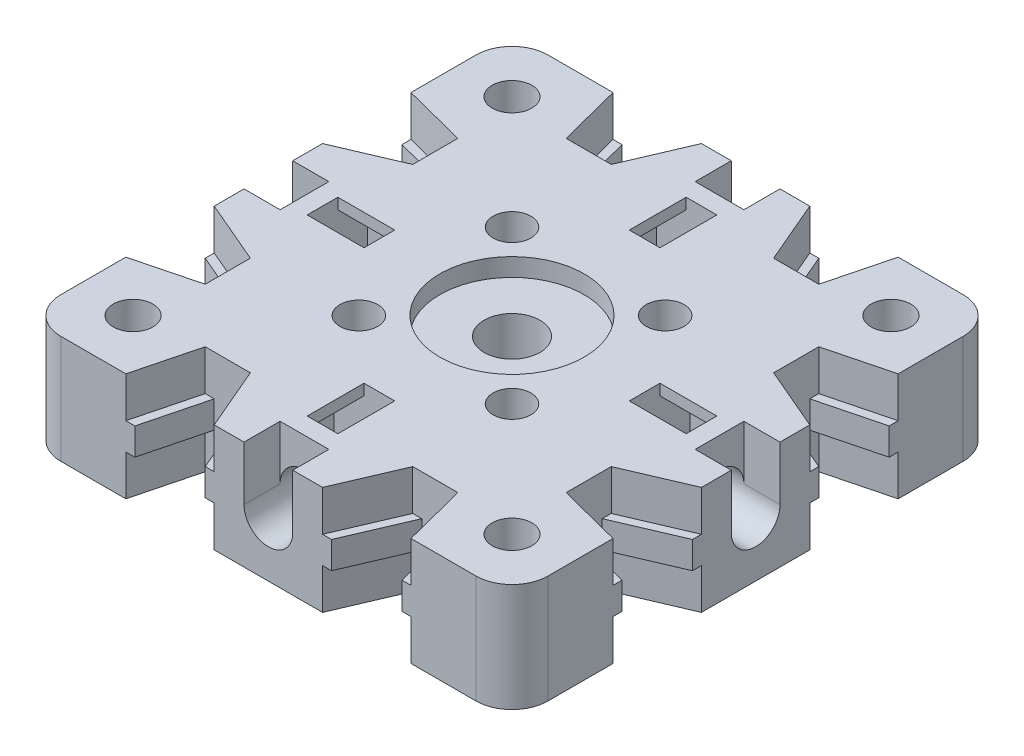
from build123d import *

# Parameters (mm, degrees)
SKETCH_3_W                      = 27
SKETCH_3_H                      = 27
EXTRUDE_1_DEPTH                 = 3
FILLET_1_R                      = 2
SKETCH_4_R                      = 1.1
CUT_EXTRUDE_1_DEPTH             = 6
SKETCH_5_R                      = 1.55
CUT_EXTRUDE_2_DEPTH             = 6
SKETCH_6_R                      = 1.05
CUT_EXTRUDE_3_DEPTH             = 6
PATTERN_CIRCULAR_1_COUNT        = 4
SKETCH_7_R                      = 4
CUT_EXTRUDE_4_DEPTH             = 1
SKETCH_8_W                      = 11.2
SKETCH_8_H                      = 11.2
CUT_EXTRUDE_5_DEPTH             = 2.5
CUT_EXTRUDE_8_DEPTH             = 21.012496096
PATTERN_CIRCULAR_2_COUNT        = 4
PATTERN_CIRCULAR_2_COPY_1_DEPTH = 21.012496096
PATTERN_CIRCULAR_2_COPY_2_DEPTH = 21.012496096
PATTERN_CIRCULAR_2_COPY_3_DEPTH = 21.012496096
SKETCH_12_R                     = 1.35
CUT_EXTRUDE_9_DEPTH             = 8
PATTERN_CIRCULAR_3_COUNT        = 4
EXTRUDE_2_DEPTH                 = 0.75
PATTERN_CIRCULAR_4_COUNT        = 4
PATTERN_CIRCULAR_4_COPY_1_DEPTH = 0.75
PATTERN_CIRCULAR_4_COPY_2_DEPTH = 0.75
PATTERN_CIRCULAR_4_COPY_3_DEPTH = 0.75
CUT_EXTRUDE_10_DEPTH            = 3.15
SKETCH_15_W                     = 2.7
SKETCH_15_H                     = 1.85
CUT_EXTRUDE_11_DEPTH            = 3
PATTERN_CIRCULAR_5_COUNT        = 4
CUT_EXTRUDE_12_DEPTH            = 4.1
CUT_EXTRUDE_13_DEPTH            = 1
PATTERN_CIRCULAR_6_COUNT        = 4
CUT_EXTRUDE_14_DEPTH            = 3.8
PATTERN_CIRCULAR_7_COUNT        = 4
SKETCH_22_W                     = 2.7
SKETCH_22_H                     = 3
CUT_EXTRUDE_15_DEPTH            = 2
CUT_EXTRUDE_16_DEPTH            = 3.5
PATTERN_CIRCULAR_8_COUNT        = 4
FILLET_2_R                      = 0.3
SKETCH_25_W                     = 3.009788056
SKETCH_25_H                     = 3.009788056
CUT_EXTRUDE_17_DEPTH            = 2.5
PATTERN_CIRCULAR_10_COUNT       = 4
FILLET_3_R                      = 0.3
PATTERN_CIRCULAR_11_COUNT       = 4


with BuildPart() as part:
    # ｽｹｯﾁ3 → ﾎﾞｽ - 押し出し1 (new, symmetric)
    with BuildSketch(Plane(origin=(0, 0, 0), x_dir=(1, 0, 0), z_dir=(0, 1, 0))):
        Rectangle(SKETCH_3_W, SKETCH_3_H)
    extrude(amount=EXTRUDE_1_DEPTH, both=True)

    # ﾌｨﾚｯﾄ1
    fillet_1_edges = [part.edges().sort_by_distance(p)[0] for p in [
        (13.5, 0, 13.5),
        (-13.5, 0, 13.5),
        (-13.5, 0, -13.5),
        (13.5, 0, -13.5),
    ]]
    fillet(fillet_1_edges, radius=FILLET_1_R)

    # ｽｹｯﾁ4 → ｶｯﾄ - 押し出し1 (cut)
    with BuildSketch(Plane(origin=(0, 3, 0), x_dir=(1, 0, 0), z_dir=(0, 1, 0))):
        with Locations(Location((-10.5, 10.5, 0), (0, 0, 270))):
            Circle(SKETCH_4_R)
        with Locations(Location((10.5, 10.5, 0), (0, 0, 270))):
            Circle(SKETCH_4_R)
        with Locations(Location((-10.5, -10.5, 0), (0, 0, 270))):
            Circle(SKETCH_4_R)
        with Locations(Location((10.5, -10.5, 0), (0, 0, 270))):
            Circle(SKETCH_4_R)
    extrude(amount=-CUT_EXTRUDE_1_DEPTH, mode=Mode.SUBTRACT)

    # ｽｹｯﾁ5 → ｶｯﾄ - 押し出し2 (cut)
    with BuildSketch(Plane(origin=(0, 3, 0), x_dir=(1, 0, 0), z_dir=(0, 1, 0))):
        with Locations(Location((0, 0, 0), (0, 0, 270))):
            Circle(SKETCH_5_R)
    extrude(amount=-CUT_EXTRUDE_2_DEPTH, mode=Mode.SUBTRACT)

    # ｽｹｯﾁ6 → ｶｯﾄ - 押し出し3 (cut)
    with BuildSketch(Plane(origin=(0, 3, 0), x_dir=(1, 0, 0), z_dir=(0, 1, 0))):
        with Locations(Location((4.242640687, 4.242640687, 0), (0, 0, 270))):
            Circle(SKETCH_6_R)
    cut_extrude_3 = extrude(amount=-CUT_EXTRUDE_3_DEPTH, mode=Mode.SUBTRACT)

    # 円形ﾊﾟﾀｰﾝ1: ｶｯﾄ - 押し出し3 ×4 about axis
    pattern_circular_1_axis = Axis((0, 0, 0), (0, 1, 0))
    for i in range(1, PATTERN_CIRCULAR_1_COUNT):
        add(cut_extrude_3.rotate(pattern_circular_1_axis, i * 360 / PATTERN_CIRCULAR_1_COUNT), mode=Mode.SUBTRACT)

    # ｽｹｯﾁ7 → ｶｯﾄ - 押し出し4 (cut)
    with BuildSketch(Plane(origin=(0, 3, 0), x_dir=(1, 0, 0), z_dir=(0, 1, 0))):
        with Locations(Location((0, 0, 0), (0, 0, 270))):
            Circle(SKETCH_7_R)
    extrude(amount=-CUT_EXTRUDE_4_DEPTH, mode=Mode.SUBTRACT)

    # ｽｹｯﾁ8 → ｶｯﾄ - 押し出し5 (cut)
    with BuildSketch(Plane.XZ.offset(3)):
        Rectangle(SKETCH_8_W, SKETCH_8_H)
    extrude(amount=-CUT_EXTRUDE_5_DEPTH, mode=Mode.SUBTRACT)

    # ｽｹｯﾁ11 → ｶｯﾄ - 押し出し8 (cut, symmetric)
    with BuildSketch(Plane(origin=(0, 3, 0), x_dir=(1, 0, 0), z_dir=(0, 1, 0))):
        Polygon((-28.082033535, 86.024744916), (3, 13.5), (4.5, 10), (7, 10), (7.9, 13.5), (27.55047658, 89.918520033), (16.532211377, 247.342544779), (-39.100298738, 243.448769662), align=None)
    cut_extrude_8 = extrude(amount=CUT_EXTRUDE_8_DEPTH, both=True, mode=Mode.SUBTRACT)

    # ﾐﾗｰ1: ｶｯﾄ - 押し出し8 across plane
    add(cut_extrude_8.mirror(Plane(origin=(0, 0, 0), x_dir=(0, 0, 1), z_dir=(1, 0, 0))), mode=Mode.SUBTRACT)

    # 円形ﾊﾟﾀｰﾝ2: ｶｯﾄ - 押し出し8 ×4 about axis
    pattern_circular_2_axis = Axis((0, 0, 0), (0, 1, 0))
    for i in range(1, PATTERN_CIRCULAR_2_COUNT):
        add(cut_extrude_8.rotate(pattern_circular_2_axis, i * 360 / PATTERN_CIRCULAR_2_COUNT), mode=Mode.SUBTRACT)

    # 円形ﾊﾟﾀｰﾝ2 copy 1 sketch → 円形ﾊﾟﾀｰﾝ2 copy 1 (cut, symmetric)
    with BuildSketch(Plane.ZX.offset(3)):
        Polygon((-28.082033535, -86.024744916), (3, -13.5), (4.5, -10), (7, -10), (7.9, -13.5), (27.55047658, -89.918520033), (16.532211377, -247.342544779), (-39.100298738, -243.448769662), align=None)
    extrude(amount=PATTERN_CIRCULAR_2_COPY_1_DEPTH, both=True, mode=Mode.SUBTRACT)

    # 円形ﾊﾟﾀｰﾝ2 copy 2 sketch → 円形ﾊﾟﾀｰﾝ2 copy 2 (cut, symmetric)
    with BuildSketch(Plane(origin=(0, 3, 0), x_dir=(1, 0, 0), z_dir=(0, 1, 0))):
        Polygon((-28.082033535, -86.024744916), (3, -13.5), (4.5, -10), (7, -10), (7.9, -13.5), (27.55047658, -89.918520033), (16.532211377, -247.342544779), (-39.100298738, -243.448769662), align=None)
    extrude(amount=PATTERN_CIRCULAR_2_COPY_2_DEPTH, both=True, mode=Mode.SUBTRACT)

    # 円形ﾊﾟﾀｰﾝ2 copy 3 sketch → 円形ﾊﾟﾀｰﾝ2 copy 3 (cut, symmetric)
    with BuildSketch(Plane(origin=(0, 3, 0), x_dir=(0, 0, -1), z_dir=(0, 1, 0))):
        Polygon((-28.082033535, -86.024744916), (3, -13.5), (4.5, -10), (7, -10), (7.9, -13.5), (27.55047658, -89.918520033), (16.532211377, -247.342544779), (-39.100298738, -243.448769662), align=None)
    extrude(amount=PATTERN_CIRCULAR_2_COPY_3_DEPTH, both=True, mode=Mode.SUBTRACT)

    # ｽｹｯﾁ12 → ｶｯﾄ - 押し出し9 (cut)
    with BuildSketch(Plane.XY.offset(13.5)):
        Circle(SKETCH_12_R)
    cut_extrude_9 = extrude(amount=-CUT_EXTRUDE_9_DEPTH, mode=Mode.SUBTRACT)

    # 円形ﾊﾟﾀｰﾝ3: ｶｯﾄ - 押し出し9 ×4 about axis
    pattern_circular_3_axis = Axis((0, 0, 0), (0, 1, 0))
    for i in range(1, PATTERN_CIRCULAR_3_COUNT):
        add(cut_extrude_9.rotate(pattern_circular_3_axis, i * 360 / PATTERN_CIRCULAR_3_COUNT), mode=Mode.SUBTRACT)

    # ｽｹｯﾁ13 → ﾎﾞｽ - 押し出し2 (add, symmetric)
    with BuildSketch(Plane(origin=(0, 0, 0), x_dir=(1, 0, 0), z_dir=(0, 1, 0))):
        Polygon((7.9, 13.5), (7, 10), (6.5, 10), (7.4, 13.5), align=None)
        Polygon((3, 13.5), (3.5, 13.5), (5, 10), (4.5, 10), align=None)
    extrude_2 = extrude(amount=EXTRUDE_2_DEPTH, both=True)

    # ﾐﾗｰ2: ﾎﾞｽ - 押し出し2 across plane
    add(extrude_2.mirror(Plane(origin=(0, 0, 0), x_dir=(0, 0, 1), z_dir=(1, 0, 0))))

    # 円形ﾊﾟﾀｰﾝ4: ﾎﾞｽ - 押し出し2 ×4 about axis
    pattern_circular_4_axis = Axis((0, 0, 0), (0, 1, 0))
    for i in range(1, PATTERN_CIRCULAR_4_COUNT):
        add(extrude_2.rotate(pattern_circular_4_axis, i * 360 / PATTERN_CIRCULAR_4_COUNT))

    # 円形ﾊﾟﾀｰﾝ4 copy 1 sketch → 円形ﾊﾟﾀｰﾝ4 copy 1 (add, symmetric)
    with BuildSketch(Plane.ZX):
        Polygon((7.9, -13.5), (7, -10), (6.5, -10), (7.4, -13.5), align=None)
        Polygon((3, -13.5), (3.5, -13.5), (5, -10), (4.5, -10), align=None)
    extrude(amount=PATTERN_CIRCULAR_4_COPY_1_DEPTH, both=True)

    # 円形ﾊﾟﾀｰﾝ4 copy 2 sketch → 円形ﾊﾟﾀｰﾝ4 copy 2 (add, symmetric)
    with BuildSketch(Plane(origin=(0, 0, 0), x_dir=(1, 0, 0), z_dir=(0, 1, 0))):
        Polygon((7.9, -13.5), (7, -10), (6.5, -10), (7.4, -13.5), align=None)
        Polygon((3, -13.5), (3.5, -13.5), (5, -10), (4.5, -10), align=None)
    extrude(amount=PATTERN_CIRCULAR_4_COPY_2_DEPTH, both=True)

    # 円形ﾊﾟﾀｰﾝ4 copy 3 sketch → 円形ﾊﾟﾀｰﾝ4 copy 3 (add, symmetric)
    with BuildSketch(Plane(origin=(0, 0, 0), x_dir=(0, 0, -1), z_dir=(0, 1, 0))):
        Polygon((7.9, -13.5), (7, -10), (6.5, -10), (7.4, -13.5), align=None)
        Polygon((3, -13.5), (3.5, -13.5), (5, -10), (4.5, -10), align=None)
    extrude(amount=PATTERN_CIRCULAR_4_COPY_3_DEPTH, both=True)

    # ｽｹｯﾁ14 → ｶｯﾄ - 押し出し10 (cut)
    with BuildSketch(Plane(origin=(0, 0, -10.5), x_dir=(-1, 0, 0), z_dir=(0, 0, -1))):
        Polygon((-2.5, -1.443375673), (0, -2.886751346), (2.5, -1.443375673), (2.5, 1.443375673), (0.85, 2.396003617), (0.85, 0), (-0.85, 0), (-0.85, 2.396003617), (-2.5, 1.443375673), align=None)
        Polygon((0, 2.886751346), (0.85, 2.396003617), (0.85, 3), (-0.85, 3), (-0.85, 2.396003617), align=None)
        Polygon((0.85, 0), (0.85, 2.396003617), (0, 2.886751346), (-0.85, 2.396003617), (-0.85, 0), align=None)
        Polygon((-2.5, -3), (2.5, -3), (2.5, -1.443375673), (0, -2.886751346), (-2.5, -1.443375673), align=None)
    cut_extrude_10 = extrude(amount=-CUT_EXTRUDE_10_DEPTH, mode=Mode.SUBTRACT)

    # ｽｹｯﾁ15 → ｶｯﾄ - 押し出し11 (cut)
    with BuildSketch(Plane.XZ.offset(3)):
        with Locations((0, -6.425)):
            Rectangle(SKETCH_15_W, SKETCH_15_H)
    cut_extrude_11 = extrude(amount=-CUT_EXTRUDE_11_DEPTH, mode=Mode.SUBTRACT)

    # 円形ﾊﾟﾀｰﾝ5: ｶｯﾄ - 押し出し10, ｶｯﾄ - 押し出し11 ×4 about axis
    pattern_circular_5_axis = Axis((0, 0, 0), (0, 1, 0))
    add([cut_extrude_10.rotate(pattern_circular_5_axis, i * 360 / PATTERN_CIRCULAR_5_COUNT) for i in range(1, PATTERN_CIRCULAR_5_COUNT)], mode=Mode.SUBTRACT)
    add([cut_extrude_11.rotate(pattern_circular_5_axis, i * 360 / PATTERN_CIRCULAR_5_COUNT) for i in range(1, PATTERN_CIRCULAR_5_COUNT)], mode=Mode.SUBTRACT)

    # ｽｹｯﾁ16 → ｶｯﾄ - 押し出し12 (cut)
    with BuildSketch(Plane.XZ.offset(3)):
        Polygon((-9.849982783, 8.074102719), (-8.074102719, 9.849982783), (-8.724119936, 12.275880064), (-11.150017217, 12.925897281), (-12.925897281, 11.150017217), (-12.275880064, 8.724119936), align=None)
    cut_extrude_12 = extrude(amount=-CUT_EXTRUDE_12_DEPTH, mode=Mode.SUBTRACT)

    # ｽｹｯﾁ17 → ｶｯﾄ - 押し出し13 (cut)
    with BuildSketch(Plane.XZ.offset(3)):
        Polygon((0.883883476, 0.883883476), (-8.838299064, 10.606066017), (-10.606066017, 8.838299064), (-0.883883476, -0.883883476), align=None)
    cut_extrude_13 = extrude(amount=-CUT_EXTRUDE_13_DEPTH, mode=Mode.SUBTRACT)

    # 円形ﾊﾟﾀｰﾝ6: ｶｯﾄ - 押し出し12, ｶｯﾄ - 押し出し13 ×4 about axis
    pattern_circular_6_axis = Axis((0, 0, 0), (0, 1, 0))
    add([cut_extrude_12.rotate(pattern_circular_6_axis, i * 360 / PATTERN_CIRCULAR_6_COUNT) for i in range(1, PATTERN_CIRCULAR_6_COUNT)], mode=Mode.SUBTRACT)
    add([cut_extrude_13.rotate(pattern_circular_6_axis, i * 360 / PATTERN_CIRCULAR_6_COUNT) for i in range(1, PATTERN_CIRCULAR_6_COUNT)], mode=Mode.SUBTRACT)

    # ｽｹｯﾁ21 → ｶｯﾄ - 押し出し14 (cut)
    with BuildSketch(Plane.XZ.offset(3)):
        Polygon((-3.637452243, 1.984046667), (-1.984046667, 3.637452243), (-2.589235111, 5.896046263), (-4.847829131, 6.501234707), (-6.501234707, 4.847829131), (-5.896046263, 2.589235111), align=None)
    cut_extrude_14 = extrude(amount=-CUT_EXTRUDE_14_DEPTH, mode=Mode.SUBTRACT)

    # 円形ﾊﾟﾀｰﾝ7: ｶｯﾄ - 押し出し14 ×4 about axis
    pattern_circular_7_axis = Axis((0, 0, 0), (0, 1, 0))
    for i in range(1, PATTERN_CIRCULAR_7_COUNT):
        add(cut_extrude_14.rotate(pattern_circular_7_axis, i * 360 / PATTERN_CIRCULAR_7_COUNT), mode=Mode.SUBTRACT)

    # ｽｹｯﾁ22 → ｶｯﾄ - 押し出し15 (cut)
    with BuildSketch(Plane.XY.offset(13.5)):
        with Locations((0, 1.5)):
            Rectangle(SKETCH_22_W, SKETCH_22_H)
    cut_extrude_15 = extrude(amount=-CUT_EXTRUDE_15_DEPTH, mode=Mode.SUBTRACT)

    # ｽｹｯﾁ23 → ｶｯﾄ - 押し出し16 (cut)
    with BuildSketch(Plane.XZ.offset(3)):
        with BuildLine():
            Line((-4.4, 8), (-8, 8))
            Line((-8, 8), (-8, 4.4))
            Line((-8, 4.4), (-7.138368238, 4.4))
            ThreePointArc((-7.138368238, 4.4), (-6.293250353, 6.293250353), (-4.4, 7.138368238))
            Line((-4.4, 7.138368238), (-4.4, 8))
        make_face()
    cut_extrude_16 = extrude(amount=-CUT_EXTRUDE_16_DEPTH, mode=Mode.SUBTRACT)

    # 円形ﾊﾟﾀｰﾝ8: ｶｯﾄ - 押し出し16 ×4 about axis
    pattern_circular_8_axis = Axis((0, 0, 0), (0, 1, 0))
    for i in range(1, PATTERN_CIRCULAR_8_COUNT):
        add(cut_extrude_16.rotate(pattern_circular_8_axis, i * 360 / PATTERN_CIRCULAR_8_COUNT), mode=Mode.SUBTRACT)

    # ﾌｨﾚｯﾄ2
    fillet_2_edges = [part.edges().sort_by_distance(p)[0] for p in [
        (-4.4, -1.25, 7.138368238),
        (-8, -1.25, 4.4),
        (-8, -0.75, 8),
        (-7.138368238, -1.25, 4.4),
        (-4.4, -1.25, 8),
        (8, -0.75, 8),
        (7.138368238, -1.25, 4.4),
        (4.4, -1.25, 8),
        (4.4, -1.25, 7.138368238),
        (8, -1.25, 4.4),
        (4.4, -1.25, -7.138368238),
        (8, -1.25, -4.4),
        (8, -0.75, -8),
        (7.138368238, -1.25, -4.4),
        (4.4, -1.25, -8),
        (-8, -0.75, -8),
        (-7.138368238, -1.25, -4.4),
        (-4.4, -1.25, -8),
        (-4.4, -1.25, -7.138368238),
        (-8, -1.25, -4.4),
    ]]
    fillet(fillet_2_edges, radius=FILLET_2_R)

    # ｽｹｯﾁ25 → ｶｯﾄ - 押し出し17 (cut)
    with BuildSketch(Plane.XZ.offset(3)):
        with Locations((-5.904894028, 5.904894028)):
            Rectangle(SKETCH_25_W, SKETCH_25_H)
    cut_extrude_17 = extrude(amount=-CUT_EXTRUDE_17_DEPTH, mode=Mode.SUBTRACT)

    # 円形ﾊﾟﾀｰﾝ10: ｶｯﾄ - 押し出し17 ×4 about axis
    pattern_circular_10_axis = Axis((0, 0, 0), (0, 1, 0))
    for i in range(1, PATTERN_CIRCULAR_10_COUNT):
        add(cut_extrude_17.rotate(pattern_circular_10_axis, i * 360 / PATTERN_CIRCULAR_10_COUNT), mode=Mode.SUBTRACT)

    # ﾌｨﾚｯﾄ3
    fillet_3_edges = [part.edges().sort_by_distance(p)[0] for p in [
        (-4.4, -1.75, 6.381239253),
        (-6.381239253, -1.75, 4.4),
        (6.381239253, -1.75, 4.4),
        (4.4, -1.75, 6.381239253),
        (4.4, -1.75, -6.381239253),
        (6.381239253, -1.75, -4.4),
        (-4.4, -1.75, -6.381239253),
        (-6.381239253, -1.75, -4.4),
    ]]
    fillet(fillet_3_edges, radius=FILLET_3_R)

    # 円形ﾊﾟﾀｰﾝ11: ｶｯﾄ - 押し出し15 ×4 about axis
    pattern_circular_11_axis = Axis((0, 0, 0), (0, 1, 0))
    for i in range(1, PATTERN_CIRCULAR_11_COUNT):
        add(cut_extrude_15.rotate(pattern_circular_11_axis, i * 360 / PATTERN_CIRCULAR_11_COUNT), mode=Mode.SUBTRACT)


solid = part.part
